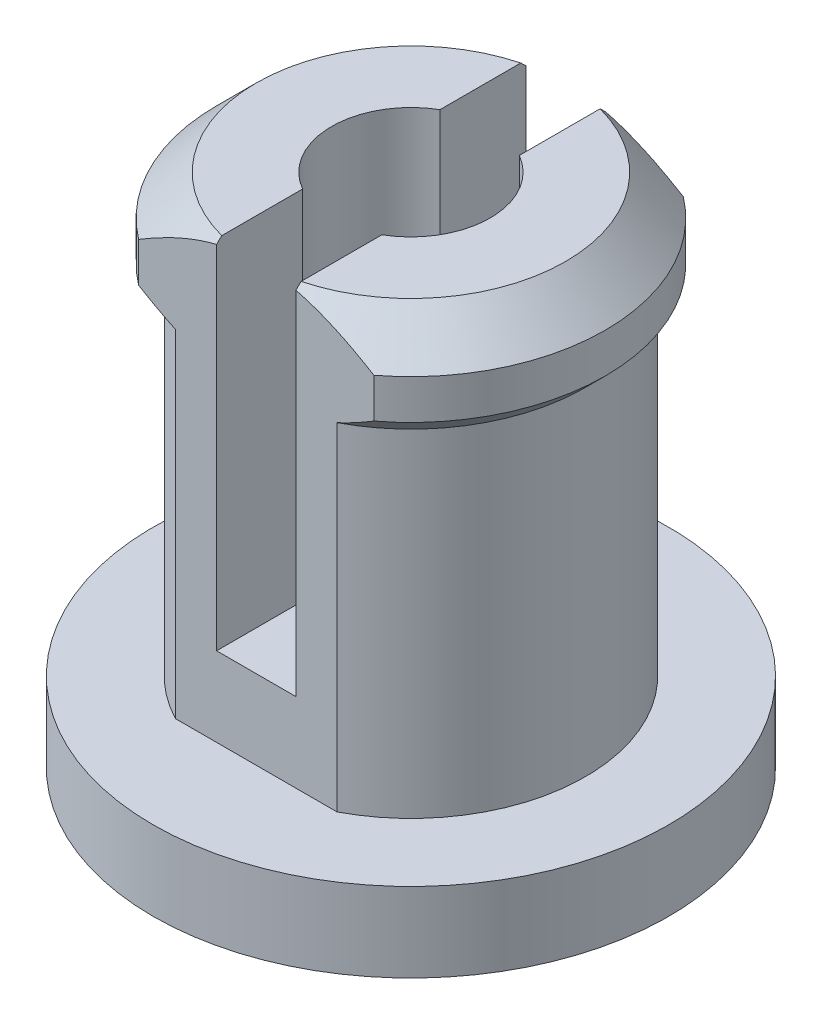
from build123d import *

# Parameters (mm, degrees)
ESBO_O1_R                = 6.5
RESSALTO_EXTRUS_O1_DEPTH = 2
ESBO_O2_R                = 4.4
RESSALTO_EXTRUS_O2_DEPTH = 8
ESBO_O3_R                = 4.9
RESSALTO_EXTRUS_O3_DEPTH = 3
CORTE_EXTRUS_O1_REACH    = 17.922
CORTE_EXTRUS_O2_DEPTH    = 9
CHANFRO1_SIZE            = 1


with BuildPart() as part:
    # Esboço1 → Ressalto-extrusão1 (new body)
    with BuildSketch(Plane(origin=(0, 0, 0), x_dir=(1, 0, 0), z_dir=(0, 1, 0))):
        with Locations(Location((0, 0, 0), (0, 0, 270))):
            Circle(ESBO_O1_R)
    extrude(amount=-RESSALTO_EXTRUS_O1_DEPTH)

    # Esboço2 → Ressalto-extrusão2 (add)
    with BuildSketch(Plane(origin=(0, 0, 0), x_dir=(1, 0, 0), z_dir=(0, 1, 0))):
        with Locations(Location((0, 0, 0), (0, 0, 270))):
            Circle(ESBO_O2_R)
    extrude(amount=RESSALTO_EXTRUS_O2_DEPTH)

    # Esboço3 → Ressalto-extrusão3 (add)
    with BuildSketch(Plane(origin=(0, 8, 0), x_dir=(1, 0, 0), z_dir=(0, 1, 0))):
        with Locations(Location((0, 0, 0), (0, 0, 270))):
            Circle(ESBO_O3_R)
    extrude(amount=RESSALTO_EXTRUS_O3_DEPTH)

    # Corte-extrusão1: up to this face of the body (flat: up to its plane)
    corte_extrus_o1_end = Plane(part.part.faces().sort_by_distance((0, 0, -6.316152237))[0])
    # Esboço4 → Corte-extrusão1 (cut, up to the picked face)
    with BuildSketch(Plane(origin=(0, 11, 0), x_dir=(1, 0, 0), z_dir=(0, 1, 0)), mode=Mode.PRIVATE) as corte_extrus_o1_sk1:
        with BuildLine():
            Line((2.966479395, -3.9), (-2.966479395, -3.9))
            ThreePointArc((-2.966479395, -3.9), (0, -4.9), (2.966479395, -3.9))
        make_face()
    corte_extrus_o1_tool1 = split(extrude(corte_extrus_o1_sk1.sketch, amount=-CORTE_EXTRUS_O1_REACH, mode=Mode.PRIVATE), bisect_by=corte_extrus_o1_end, keep=Keep.BOTH, mode=Mode.PRIVATE)
    # Esboço4 → Corte-extrusão1 (cut, up to the picked face)
    with BuildSketch(Plane(origin=(0, 11, 0), x_dir=(1, 0, 0), z_dir=(0, 1, 0)), mode=Mode.PRIVATE) as corte_extrus_o1_sk2:
        with BuildLine():
            ThreePointArc((2.966479395, 3.9), (0, 4.9), (-2.966479395, 3.9))
            Line((-2.966479395, 3.9), (2.966479395, 3.9))
        make_face()
    corte_extrus_o1_tool2 = split(extrude(corte_extrus_o1_sk2.sketch, amount=-CORTE_EXTRUS_O1_REACH, mode=Mode.PRIVATE), bisect_by=corte_extrus_o1_end, keep=Keep.BOTH, mode=Mode.PRIVATE)
    add(corte_extrus_o1_tool1.solids().sort_by(Axis((0, 11, 4.303719), (0, -1, 0)))[0], mode=Mode.SUBTRACT)
    add(corte_extrus_o1_tool2.solids().sort_by(Axis((0, 11, -4.303719), (0, -1, 0)))[0], mode=Mode.SUBTRACT)

    # Esboço5 → Corte-extrusão2 (cut)
    with BuildSketch(Plane(origin=(0, 11, 0), x_dir=(1, 0, 0), z_dir=(0, 1, 0))):
        with BuildLine():
            Line((0, 2), (0, 3.9))
            Line((0, 3.9), (-1, 3.9))
            Line((-1, 3.9), (-1, 1.732050808))
            ThreePointArc((-1, 1.732050808), (-0.51763809, 1.931851653), (0, 2))
        make_face()
        with BuildLine():
            Line((1, 3.9), (0, 3.9))
            Line((0, 3.9), (0, 2))
            ThreePointArc((0, 2), (0.51763809, 1.931851653), (1, 1.732050808))
            Line((1, 1.732050808), (1, 3.9))
        make_face()
        with BuildLine():
            Line((0, -3.9), (0, -2))
            ThreePointArc((0, -2), (-0.51763809, -1.931851653), (-1, -1.732050808))
            Line((-1, -1.732050808), (-1, -3.9))
            Line((-1, -3.9), (0, -3.9))
        make_face()
        with BuildLine():
            ThreePointArc((1, -1.732050808), (0.51763809, -1.931851653), (0, -2))
            Line((0, -2), (0, -3.9))
            Line((0, -3.9), (1, -3.9))
            Line((1, -3.9), (1, -1.732050808))
        make_face()
        with BuildLine():
            Line((0, -2), (0, 2))
            ThreePointArc((0, 2), (-0.51763809, 1.931851653), (-1, 1.732050808))
            Line((-1, 1.732050808), (-1, -1.732050808))
            ThreePointArc((-1, -1.732050808), (-0.51763809, -1.931851653), (0, -2))
        make_face()
        with BuildLine():
            ThreePointArc((1, 1.732050808), (0.51763809, 1.931851653), (0, 2))
            Line((0, 2), (0, -2))
            ThreePointArc((0, -2), (0.51763809, -1.931851653), (1, -1.732050808))
            Line((1, -1.732050808), (1, 1.732050808))
        make_face()
        with BuildLine():
            Line((-1, -1.732050808), (-1, 1.732050808))
            ThreePointArc((-1, 1.732050808), (-2, 0), (-1, -1.732050808))
        make_face()
        with BuildLine():
            ThreePointArc((2, 0), (1.732050808, 1), (1, 1.732050808))
            Line((1, 1.732050808), (1, -1.732050808))
            ThreePointArc((1, -1.732050808), (1.732050808, -1), (2, 0))
        make_face()
    extrude(amount=-CORTE_EXTRUS_O2_DEPTH, mode=Mode.SUBTRACT)

    # Chanfro1
    # the kernel refuses this chamfer: 1 mm, written as the material it takes off along each edge
    with BuildSketch(Plane(origin=(0, 8, 0), x_dir=(0.12482395655997021, 0, 0.9921789051722048), z_dir=(-0.9921789051722048, 0, 0.12482395655997021))) as chanfro1_piece_1_section:
        Polygon((4.9, CHANFRO1_SIZE), (4.9 - CHANFRO1_SIZE, 0), (4.9, 0), align=None)
    chanfro1_piece_1 = revolve(axis=Axis((0, 8, 0), (0, 1, 0)), revolution_arc=165.658820776, mode=Mode.PRIVATE)
    chanfro1_piece_1 = chanfro1_piece_1 - Plane(origin=(0, 8.751624074, 0), x_dir=(0, 0, 1), z_dir=(0, -1, 0)) * Cylinder(4.4, 20, mode=Mode.PRIVATE)
    add(chanfro1_piece_1, mode=Mode.SUBTRACT)
    with BuildSketch(Plane(origin=(0, 8, 0), x_dir=(-0.12482395656001569, 0, -0.9921789051721989), z_dir=(0.9921789051721989, 0, -0.12482395656001569))) as chanfro1_piece_2_section:
        Polygon((4.9 - CHANFRO1_SIZE, 0), (4.9, CHANFRO1_SIZE), (4.9, 0), align=None)
    chanfro1_piece_2 = revolve(axis=Axis((0, 8, 0), (0, 1, 0)), revolution_arc=165.658820776, mode=Mode.PRIVATE)
    chanfro1_piece_2 = chanfro1_piece_2 - Plane(origin=(0, 8.751624074, 0), x_dir=(0, 0, 1), z_dir=(0, -1, 0)) * Cylinder(4.4, 20, mode=Mode.PRIVATE)
    add(chanfro1_piece_2, mode=Mode.SUBTRACT)
    with BuildSketch(Plane(origin=(0, 11, 0), x_dir=(-0.124823956560002, 0, -0.9921789051722005), z_dir=(0.9921789051722005, 0, -0.124823956560002))) as chanfro1_piece_3:
        Polygon((4.9 - CHANFRO1_SIZE, 0), (4.9, -CHANFRO1_SIZE), (4.9, 0), align=None)
    revolve(axis=Axis((0, 11, 0), (0, 1, 0)), revolution_arc=165.658820776, mode=Mode.SUBTRACT)
    with BuildSketch(Plane(origin=(0, 11, 0), x_dir=(0.12482395656000247, 0, 0.9921789051722005), z_dir=(-0.9921789051722005, 0, 0.12482395656000247))) as chanfro1_piece_4:
        Polygon((4.9, -CHANFRO1_SIZE), (4.9 - CHANFRO1_SIZE, 0), (4.9, 0), align=None)
    revolve(axis=Axis((0, 11, 0), (0, 1, 0)), revolution_arc=165.658820776, mode=Mode.SUBTRACT)


solid = part.part
